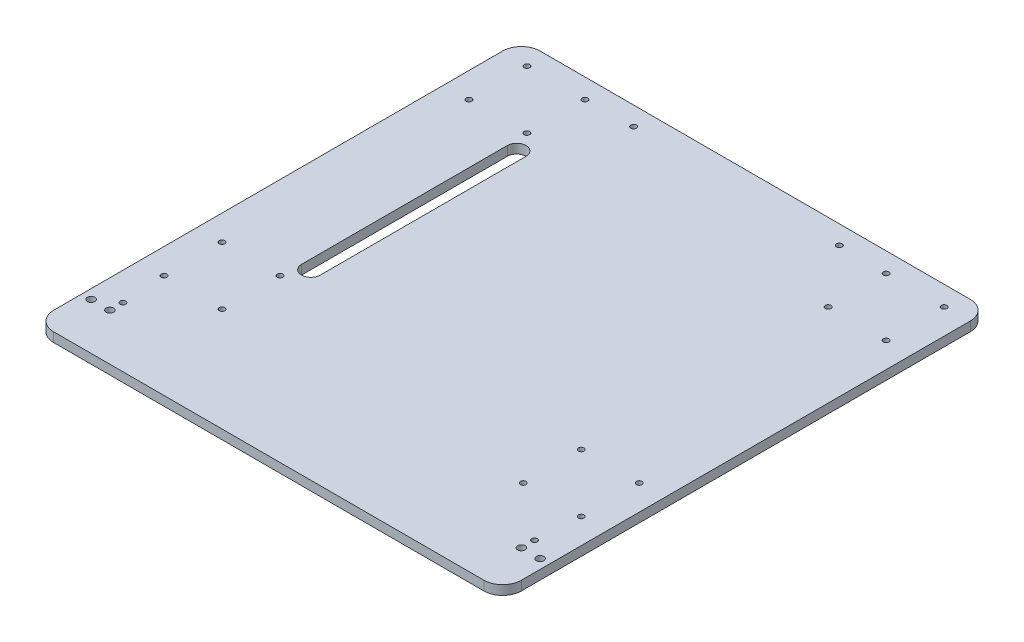
from build123d import *

# Parameters (mm, degrees)
SKETCH_1_W      = 250
SKETCH_1_H      = 260
SKETCH_1_R      = 1.5
SKETCH_1_R_2    = 2
EXTRUDE_1_DEPTH = 5
FILLET_2_R      = 10


with BuildPart() as part:
    # 草图1 → 凸台-拉伸1 (new body)
    with BuildSketch(Plane(origin=(0, 0, 0), x_dir=(1, 0, 0), z_dir=(0, 1, 0))):
        Rectangle(SKETCH_1_W, SKETCH_1_H)
        with Locations((-111.5, 119.5)):
            Circle(SKETCH_1_R, mode=Mode.SUBTRACT)
        with Locations((-80.5, 119.5)):
            Circle(SKETCH_1_R, mode=Mode.SUBTRACT)
        with Locations((-80.5, 88.5)):
            Circle(SKETCH_1_R, mode=Mode.SUBTRACT)
        with Locations((-111.5, 88.5)):
            Circle(SKETCH_1_R, mode=Mode.SUBTRACT)
        with Locations((-111.5, -43.5)):
            Circle(SKETCH_1_R, mode=Mode.SUBTRACT)
        with Locations((-80.5, -43.5)):
            Circle(SKETCH_1_R, mode=Mode.SUBTRACT)
        with Locations((-80.5, -74.5)):
            Circle(SKETCH_1_R, mode=Mode.SUBTRACT)
        with Locations((-111.5, -74.5)):
            Circle(SKETCH_1_R, mode=Mode.SUBTRACT)
        with Locations((111.5, -74.5)):
            Circle(SKETCH_1_R, mode=Mode.SUBTRACT)
        with Locations((80.5, -74.5)):
            Circle(SKETCH_1_R, mode=Mode.SUBTRACT)
        with Locations((80.5, -43.5)):
            Circle(SKETCH_1_R, mode=Mode.SUBTRACT)
        with Locations((111.5, -43.5)):
            Circle(SKETCH_1_R, mode=Mode.SUBTRACT)
        with Locations((111.5, 88.5)):
            Circle(SKETCH_1_R, mode=Mode.SUBTRACT)
        with Locations((80.5, 88.5)):
            Circle(SKETCH_1_R, mode=Mode.SUBTRACT)
        with Locations((80.5, 119.5)):
            Circle(SKETCH_1_R, mode=Mode.SUBTRACT)
        with Locations((111.5, 119.5)):
            Circle(SKETCH_1_R, mode=Mode.SUBTRACT)
        with Locations((-120, -105)):
            Circle(SKETCH_1_R_2, mode=Mode.SUBTRACT)
        with Locations((-110, -105)):
            Circle(SKETCH_1_R_2, mode=Mode.SUBTRACT)
        with Locations((110, -105)):
            Circle(SKETCH_1_R_2, mode=Mode.SUBTRACT)
        with Locations((120, -105)):
            Circle(SKETCH_1_R_2, mode=Mode.SUBTRACT)
        with Locations((-55, 120)):
            Circle(SKETCH_1_R, mode=Mode.SUBTRACT)
        with Locations((55, 120)):
            Circle(SKETCH_1_R, mode=Mode.SUBTRACT)
        with Locations((-110, -98)):
            Circle(SKETCH_1_R, mode=Mode.SUBTRACT)
        with Locations((110, -98)):
            Circle(SKETCH_1_R, mode=Mode.SUBTRACT)
        with BuildLine():
            Line((-70, 77.5), (-70, -32.5))
            ThreePointArc((-70, -32.5), (-75, -37.5), (-80, -32.5))
            Line((-80, -32.5), (-80, 77.5))
            ThreePointArc((-80, 77.5), (-75, 82.5), (-70, 77.5))
        make_face(mode=Mode.SUBTRACT)
    extrude(amount=EXTRUDE_1_DEPTH)

    # 圆角2
    fillet_2_edges = [part.edges().sort_by_distance(p)[0] for p in [
        (125, 2.5, -130),
        (125, 2.5, 130),
        (-125, 2.5, -130),
        (-125, 2.5, 130),
    ]]
    fillet(fillet_2_edges, radius=FILLET_2_R)


solid = part.part
